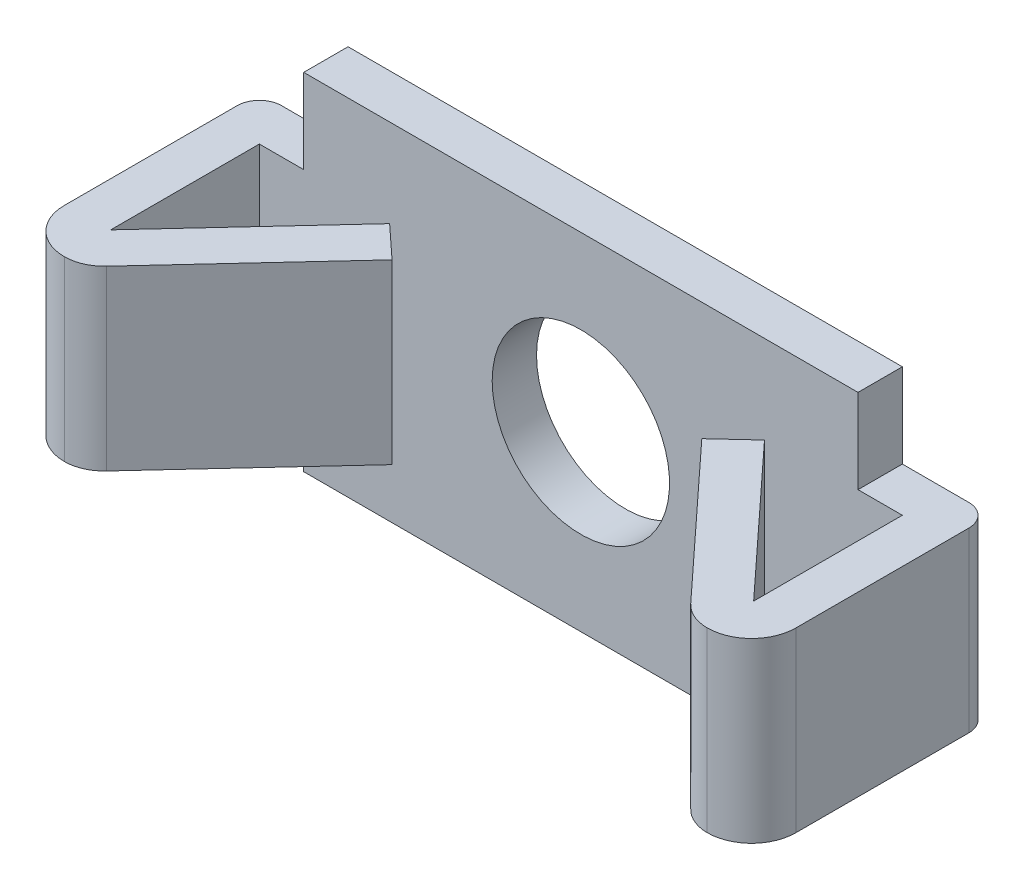
from build123d import *

# Parameters (mm, degrees)
SKETCH_1_W          = 33
SKETCH_1_H          = 15.6
EXTRUDE_1_DEPTH     = 2
SKETCH_2_W          = 4
SKETCH_2_H          = 3.8
CUT_EXTRUDE_1_DEPTH = 19.360010893
SKETCH_4_W          = 10.8
SKETCH_4_H          = 8
EXTRUDE_2_DEPTH     = 2
EXTRUDE_4_DEPTH     = 8
SKETCH_6_R          = 4
CUT_EXTRUDE_2_DEPTH = 22.20683852
FILLET_1_R          = 2
FILLET_2_R          = 1


with BuildPart() as part:
    # 草图1 → 凸台-拉伸1 (new body)
    with BuildSketch(Plane.XY):
        Rectangle(SKETCH_1_W, SKETCH_1_H)
    extrude(amount=EXTRUDE_1_DEPTH)

    # 草图2 → 切除-拉伸1 (cut, through all)
    with BuildSketch(Plane.XY.offset(2)):
        with Locations((-14.5, 5.9)):
            Rectangle(SKETCH_2_W, SKETCH_2_H)
        with Locations((14.5, 5.9)):
            Rectangle(SKETCH_2_W, SKETCH_2_H)
        with Locations((-14.5, -5.9)):
            Rectangle(SKETCH_2_W, SKETCH_2_H)
        with Locations((14.5, -5.9)):
            Rectangle(SKETCH_2_W, SKETCH_2_H)
    extrude(amount=-CUT_EXTRUDE_1_DEPTH, mode=Mode.SUBTRACT)

    # 草图4 → 凸台-拉伸2 (add)
    with BuildSketch(Plane.ZY.offset(16.5)):
        with Locations((5.4, 0)):
            Rectangle(SKETCH_4_W, SKETCH_4_H)
    extrude_2 = extrude(amount=-EXTRUDE_2_DEPTH)

    # 草图5 → 凸台-拉伸4 (add)
    with BuildSketch(Plane(origin=(0, 4, 0), x_dir=(1, 0, 0), z_dir=(0, 1, 0))):
        with BuildLine():
            Line((-8.45327815, -2.172085136), (-14.5, -8.707152989))
            Line((-14.5, -8.707152989), (-14.5, -10.8))
            ThreePointArc((-14.5, -10.8), (-13.774891977, -10.64781178), (-13.172160334, -10.216931904))
            Line((-13.172160334, -10.216931904), (-6.985279062, -3.530385058))
            Line((-6.985279062, -3.530385058), (-8.45327815, -2.172085136))
        make_face()
    extrude_4 = extrude(amount=-EXTRUDE_4_DEPTH)

    # 草图6 → 切除-拉伸2 (cut, through all)
    with BuildSketch(Plane(origin=(0, 0, 0), x_dir=(-1, 0, 0), z_dir=(0, 0, -1))):
        Circle(SKETCH_6_R)
    extrude(amount=-CUT_EXTRUDE_2_DEPTH, mode=Mode.SUBTRACT)

    # 镜向2: 凸台-拉伸2 across plane
    add(extrude_2.mirror(Plane(origin=(0, 0, 0), x_dir=(0, 0, 1), z_dir=(1, 0, 0))))

    # 镜向3: 凸台-拉伸4 across plane
    add(extrude_4.mirror(Plane(origin=(0, 0, 0), x_dir=(0, 0, 1), z_dir=(1, 0, 0))))

    # 圆角1
    fillet_1_edges = [part.edges().sort_by_distance(p)[0] for p in [
        (16.5, 0, 10.8),
        (-16.5, 0, 10.8),
    ]]
    fillet(fillet_1_edges, radius=FILLET_1_R - 0.0001)  # a hair under: the kernel refuses the full size

    # 圆角2
    fillet_2_edges = [part.edges().sort_by_distance(p)[0] for p in [
        (-16.5, 0, 0),
        (16.5, 0, 0),
    ]]
    fillet(fillet_2_edges, radius=FILLET_2_R)


solid = part.part
